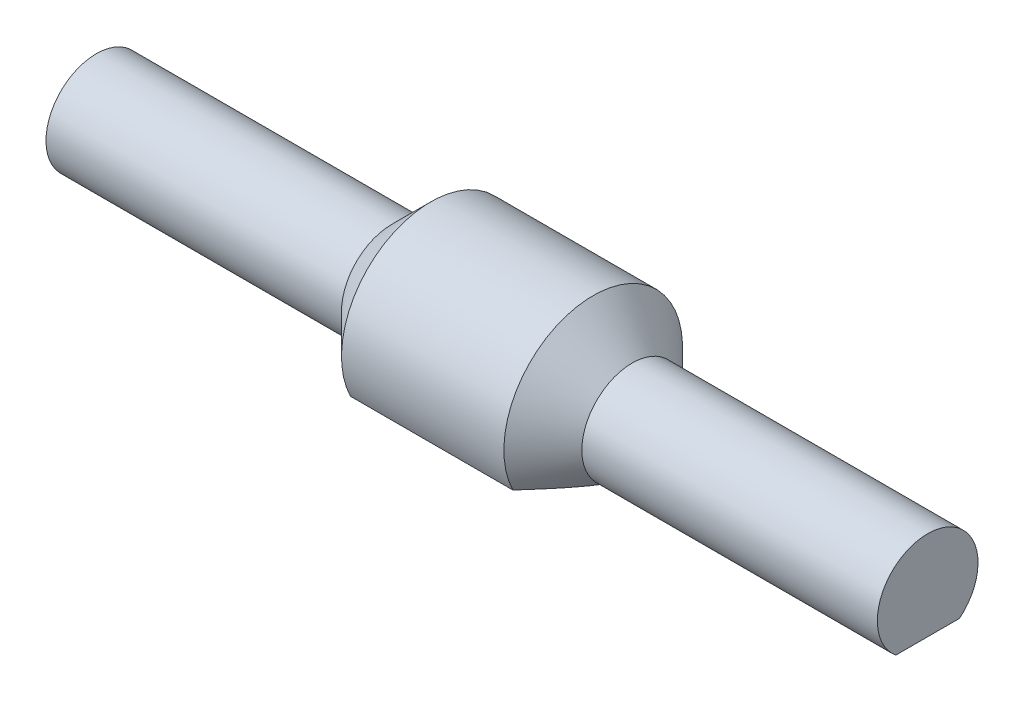
from build123d import *

# Parameters (mm, degrees)
CUT_EXTRUDE1_DEPTH      = 14.377780085
CUT_EXTRUDE1_DEPTH_BACK = 14.377780085


with BuildPart() as part:
    # Sketch2 → Revolve1 (revolve)
    with BuildSketch(Plane.XY):
        Polygon((12.8, 0), (12.8, 1.55), (3.7, 1.55), (2.5, 2.75), (0, 2.75), (0, 0), align=None)
    revolve1 = revolve(axis=Axis((-20, 0, 0), (1, 0, 0)))

    # Mirror1: Revolve1 across plane
    add(revolve1.mirror(Plane(origin=(0, 0, 0), x_dir=(0, 0, 1), z_dir=(1, 0, 0))))

    # Sketch3 → Cut-Extrude1 (cut, two sides: drawn at the far end of the back side and taken through both)
    with BuildSketch(Plane.XY.offset(-CUT_EXTRUDE1_DEPTH_BACK)):
        Polygon((-74.605887696, -1.2), (-12.8, -1.2), (12.8, -1.2), (74.605887696, -1.2), (74.605887696, -124.811775393), (-74.605887696, -124.811775393), align=None)
    extrude(amount=CUT_EXTRUDE1_DEPTH + CUT_EXTRUDE1_DEPTH_BACK, mode=Mode.SUBTRACT)


solid = part.part
